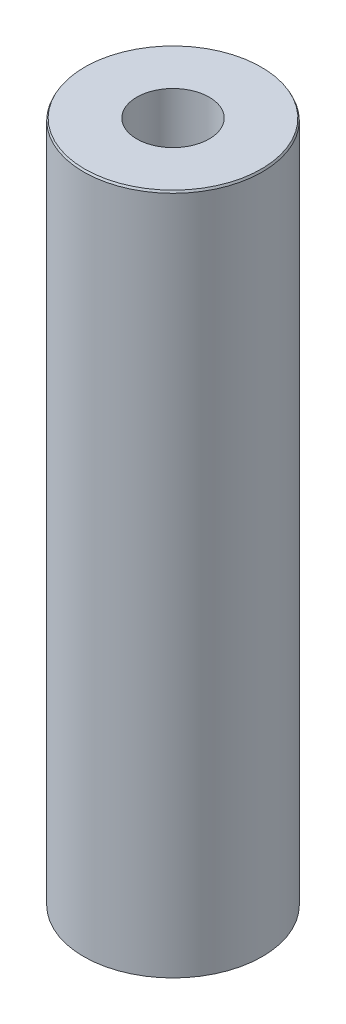
from build123d import *
from OCP.BRepFilletAPI import BRepFilletAPI_MakeChamfer

# Parameters (mm, degrees)
SKETCH1_R           = 37.5
BOSS_EXTRUDE1_DEPTH = 286.53252754
SKETCH2_R           = 15.21403621
CUT_EXTRUDE1_DEPTH  = 292.399020826
CHAMFER1_SIZE       = 0.854503776
CHAMFER1_SIZE2      = 0.420111812


with BuildPart() as part:
    # Sketch1 → Boss-Extrude1 (new body)
    with BuildSketch(Plane(origin=(0, 0, 0), x_dir=(1, 0, 0), z_dir=(0, 1, 0))):
        Circle(SKETCH1_R)
    extrude(amount=BOSS_EXTRUDE1_DEPTH)

    # Sketch2 → Cut-Extrude1 (cut, through all)
    with BuildSketch(Plane(origin=(0, 0, 0), x_dir=(1, 0, 0), z_dir=(0, 1, 0))):
        Circle(SKETCH2_R)
    extrude(amount=CUT_EXTRUDE1_DEPTH, mode=Mode.SUBTRACT)

    # Chamfer1: one chamfer whose edges measure the first distance from different faces: ONE call of the kernel's chamfer builder (chamfer() names one face for all edges)
    chamfer1_edges_1 = [part.edges().sort_by_distance(p)[0] for p in [
        (-37.5, 286.53252754, 0),
    ]]
    chamfer1_side_1 = [part.faces().sort_by_distance(p)[0] for p in [
        (-37.5, 143.26626377, 0),
    ]]
    chamfer1_edges_2 = [part.edges().sort_by_distance(p)[0] for p in [
        (-37.5, 0, 0),
    ]]
    chamfer1_side_2 = [part.faces().sort_by_distance(p)[0] for p in [
        (-36.439339828, 0, 0),
    ]]
    chamfer1 = BRepFilletAPI_MakeChamfer(part.part.solid().wrapped)
    for e in chamfer1_edges_1:
        chamfer1.Add(CHAMFER1_SIZE, CHAMFER1_SIZE2, e.wrapped, chamfer1_side_1[0].wrapped)  # the first distance lies on this face
    for e in chamfer1_edges_2:
        chamfer1.Add(CHAMFER1_SIZE, CHAMFER1_SIZE2, e.wrapped, chamfer1_side_2[0].wrapped)  # the first distance lies on this face
    add(Compound.cast(chamfer1.Shape()), mode=Mode.REPLACE)


solid = part.part
